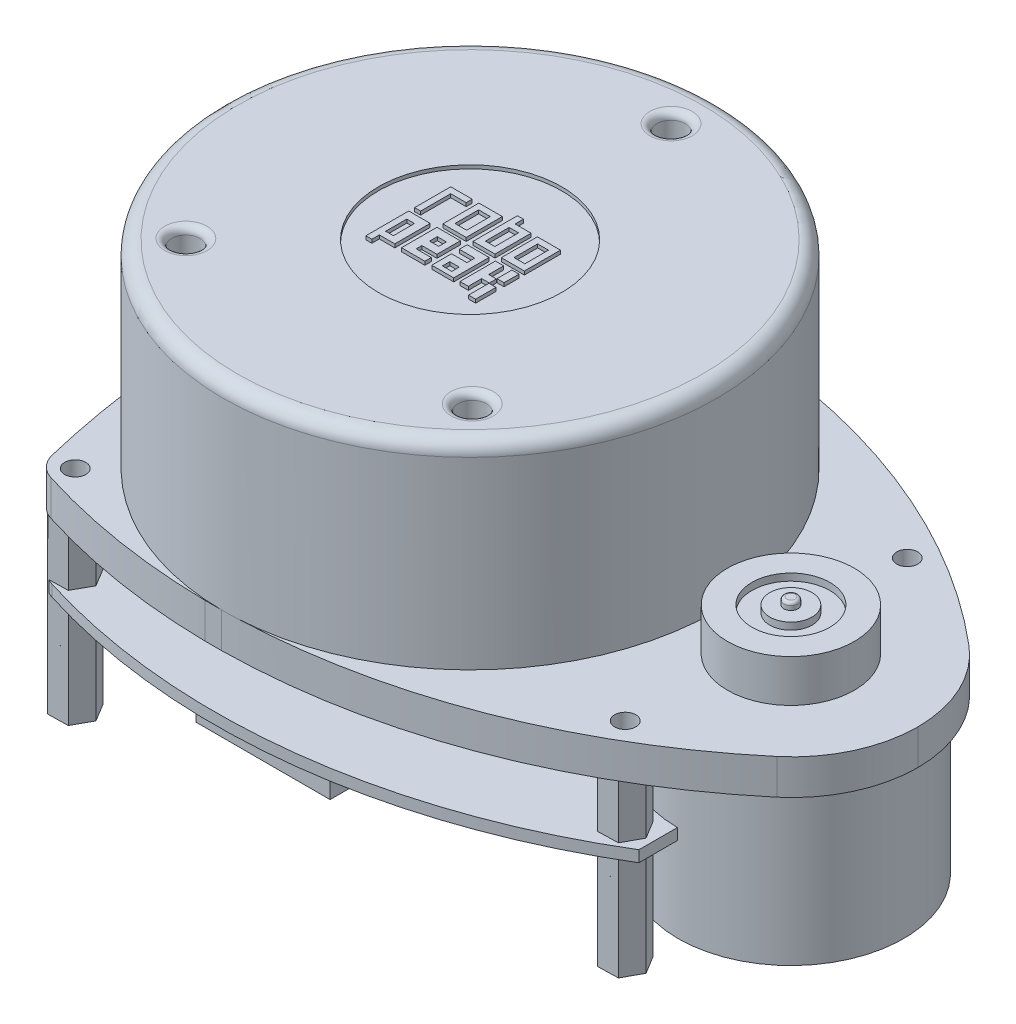
from build123d import *

# Parameters (mm, degrees)
SKETCH_1_W          = 98.5
SKETCH_1_H          = 70
EXTRUDE_1_DEPTH     = 5
SKETCH_2_R          = 35
EXTRUDE_2_DEPTH     = 28.1
SKETCH_3_R          = 2
CUT_EXTRUDE_1_DEPTH = 5
FILLET_1_R          = 2
FILLET_2_R          = 1
SKETCH_4_R          = 13
SKETCH_4_W          = 3.316540618
SKETCH_4_H          = 5.120069114
SKETCH_4_W_2        = 3.276095001
SKETCH_4_W_3        = 1.001370982
SKETCH_4_H_2        = 2.121481923
SKETCH_4_H_3        = 2.893302243
SKETCH_4_W_4        = 1.096399653
SKETCH_4_H_4        = 2.99297568
SKETCH_4_W_5        = 1.536933457
SKETCH_4_H_5        = 3.356986235
SKETCH_4_W_6        = 1.658270309
SKETCH_4_W_7        = 1.334705371
SKETCH_4_H_6        = 1.05158605
SKETCH_4_W_8        = 1.294259754
SKETCH_4_H_7        = 1.092031667
CUT_EXTRUDE_3_DEPTH = 0.5
SKETCH_5_R          = 1.25
CUT_EXTRUDE_4_DEPTH = 5
SKETCH_6_R          = 9
EXTRUDE_3_DEPTH     = 7
CUT_EXTRUDE_START   = -1
SKETCH_7_R          = 9
SKETCH_7_R_2        = 0.99350654
CUT_EXTRUDE_5_DEPTH = 1
SKETCH_8_R          = 5.521677929
SKETCH_8_R_2        = 3.001097475
CUT_EXTRUDE_6_DEPTH = 1
FILLET_3_R          = 0.4
SKETCH_9_R          = 16
EXTRUDE_4_DEPTH     = 27
EXTRUDE_5_DEPTH     = 24.6
SKETCH_11_R         = 26
EXTRUDE_6_DEPTH     = 8
FILLET_4_R          = 1
SKETCH_12_W         = 106.251501727
SKETCH_12_H         = 75.565901032
CUT_EXTRUDE_7_DEPTH = 8
FILLET_5_R          = 100
EXTRUDE_START       = 8
EXTRUDE_7_DEPTH     = 1.6
SKETCH_14_W         = 20
SKETCH_14_H         = 5
EXTRUDE_8_DEPTH     = 6
CHAMFER_1_SIZE      = 1
SKETCH1_R           = 1.5
CUT_EXTRUDE1_DEPTH  = 30


with BuildPart() as part:
    # Эскиз1 → Бобышка-Вытянуть1 (new body)
    with BuildSketch(Plane(origin=(0, 0, 0), x_dir=(1, 0, 0), z_dir=(0, 1, 0))):
        Rectangle(SKETCH_1_W, SKETCH_1_H)
    extrude(amount=EXTRUDE_1_DEPTH)

    # Эскиз2 → Бобышка-Вытянуть2 (add)
    with BuildSketch(Plane(origin=(0, 5, 0), x_dir=(1, 0, 0), z_dir=(0, 1, 0))):
        with Locations(Location((-14.25, 0, 0), (0, 0, 270))):
            Circle(SKETCH_2_R)
    extrude(amount=EXTRUDE_2_DEPTH)

    # Эскиз3 → Вырез-Вытянуть1 (cut)
    with BuildSketch(Plane(origin=(0, 33.1, 0), x_dir=(1, 0, 0), z_dir=(0, 1, 0))):
        with Locations(Location((-14.25, 28.5, 0), (0, 0, 270))):
            Circle(SKETCH_3_R)
        with Locations(Location((-34.553940504, -20, 0), (0, 0, 270))):
            Circle(SKETCH_3_R)
        with Locations(Location((6.053940504, -20, 0), (0, 0, 270))):
            Circle(SKETCH_3_R)
    extrude(amount=-CUT_EXTRUDE_1_DEPTH, mode=Mode.SUBTRACT)

    # Скругление1
    fillet_1_edges = [part.edges().sort_by_distance(p)[0] for p in [
        (-14.25, 33.1, -35),
    ]]
    fillet(fillet_1_edges, radius=FILLET_1_R)

    # Скругление2
    fillet_2_edges = [part.edges().sort_by_distance(p)[0] for p in [
        (-14.25, 33.1, -30.5),
        (-34.553940504, 33.1, 18),
        (6.053940504, 33.1, 18),
    ]]
    fillet(fillet_2_edges, radius=FILLET_2_R)

    # Эскиз4 → Вырез-Вытянуть3 (cut)
    # profile 1 of 7: a face of its own
    with BuildSketch(Plane(origin=(0, 33.1, 0), x_dir=(1, 0, 0), z_dir=(0, 1, 0))):
        with Locations(Location((-14.25, 0, 0), (0, 0, 270))):
            Circle(SKETCH_4_R)
        Polygon((-22.115166942, -6.914876839), (-22.115166942, -0.831627154), (-19.0735421, -0.831627154), (-19.0735421, -5.853844917), (-21.266341405, -5.853844917), (-21.266341405, -6.914876839), align=None, mode=Mode.SUBTRACT)
        Polygon((-22.115166942, 0), (-22.115166942, 5.120069114), (-19.0735421, 5.120069114), (-19.0735421, 4.27071115), (-21.266341405, 4.27071115), (-21.266341405, 0), align=None, mode=Mode.SUBTRACT)
        Polygon((-13.829606569, 0), (-13.829606569, 6.292992015), (-12.980248606, 6.292992015), (-12.980248606, 5.120069114), (-10.715294037, 5.120069114), (-10.715294037, 0), align=None, mode=Mode.SUBTRACT)
        with Locations((-16.458571693, 2.560034557)):
            Rectangle(SKETCH_4_W, SKETCH_4_H, mode=Mode.SUBTRACT)
        with Locations((-8.187442955, 2.560034557)):
            Rectangle(SKETCH_4_W_2, SKETCH_4_H, mode=Mode.SUBTRACT)
        with Locations((-7.050080946, -1.825090787)):
            Rectangle(SKETCH_4_W_3, SKETCH_4_H_2, mode=Mode.SUBTRACT)
        with Locations((-7.050080946, -5.468225718)):
            Rectangle(SKETCH_4_W_3, SKETCH_4_H_3, mode=Mode.SUBTRACT)
        Polygon((-9.825490456, -0.831627154), (-8.643651064, -0.831627154), (-8.643651064, -2.960833634), (-7.550766437, -2.960833634), (-7.550766437, -3.957287265), (-8.643651064, -3.957287265), (-8.643651064, -5.853844917), (-9.825490456, -5.853844917), align=None, mode=Mode.SUBTRACT)
        Polygon((-13.829606569, -0.831627154), (-10.715294037, -0.831627154), (-10.715294037, -5.853844917), (-13.829606569, -5.853844917), (-13.829606569, -3.04994558), (-11.645543235, -3.04994558), (-11.645543235, -1.940786367), (-13.829606569, -1.940786367), align=None, mode=Mode.SUBTRACT)
        Polygon((-18.116842002, -0.831627154), (-14.800301384, -0.831627154), (-14.800301384, -4.141977247), (-16.943919101, -4.141977247), (-16.943919101, -4.950889593), (-14.800301384, -4.950889593), (-14.800301384, -5.853844917), (-18.116842002, -5.853844917), align=None, mode=Mode.SUBTRACT)
    # profile 2 of 7: a face of its own
    with BuildSketch(Plane(origin=(0, 33.1, 0), x_dir=(1, 0, 0), z_dir=(0, 1, 0))):
        with Locations((-20.718141579, -3.454401753)):
            Rectangle(SKETCH_4_W_4, SKETCH_4_H_4)
    # profile 3 of 7: a face of its own
    with BuildSketch(Plane(origin=(0, 33.1, 0), x_dir=(1, 0, 0), z_dir=(0, 1, 0))):
        with Locations((-8.167220148, 2.592218033)):
            Rectangle(SKETCH_4_W_5, SKETCH_4_H_5)
    # profile 4 of 7: a face of its own
    with BuildSketch(Plane(origin=(0, 33.1, 0), x_dir=(1, 0, 0), z_dir=(0, 1, 0))):
        with Locations((-16.478794502, 2.592218033)):
            Rectangle(SKETCH_4_W_6, SKETCH_4_H_5)
    # profile 5 of 7: a face of its own
    with BuildSketch(Plane(origin=(0, 33.1, 0), x_dir=(1, 0, 0), z_dir=(0, 1, 0))):
        with Locations((-12.312895921, 2.592218033)):
            Rectangle(SKETCH_4_W_7, SKETCH_4_H_5)
    # profile 6 of 7: a face of its own
    with BuildSketch(Plane(origin=(0, 33.1, 0), x_dir=(1, 0, 0), z_dir=(0, 1, 0))):
        with Locations((-12.312895921, -4.667770272)):
            Rectangle(SKETCH_4_W_7, SKETCH_4_H_6)
    # profile 7 of 7: a face of its own
    with BuildSketch(Plane(origin=(0, 33.1, 0), x_dir=(1, 0, 0), z_dir=(0, 1, 0))):
        with Locations((-16.296789224, -2.503929746)):
            Rectangle(SKETCH_4_W_8, SKETCH_4_H_7)
    extrude(amount=-CUT_EXTRUDE_3_DEPTH, mode=Mode.SUBTRACT)

    # Эскиз5 → Вырез-Вытянуть4 (cut)
    with BuildSketch(Plane(origin=(0, 5, 0), x_dir=(1, 0, 0), z_dir=(0, 1, 0))):
        with Locations(Location((-42.25, 28, 0), (0, 0, 270))):
            Circle(SKETCH_5_R)
        with Locations(Location((27.75, 20, 0), (0, 0, 270))):
            Circle(SKETCH_5_R)
        with Locations(Location((27.75, -20, 0), (0, 0, 90))):
            Circle(SKETCH_5_R)
        with Locations(Location((-42.25, -28, 0), (0, 0, 90))):
            Circle(SKETCH_5_R)
    extrude(amount=-CUT_EXTRUDE_4_DEPTH, mode=Mode.SUBTRACT)

    # Эскиз6 → Бобышка-Вытянуть3 (add)
    with BuildSketch(Plane(origin=(0, 5, 0), x_dir=(1, 0, 0), z_dir=(0, 1, 0))):
        with Locations(Location((31.25, 0, 0), (0, 0, 270))):
            Circle(SKETCH_6_R)
    extrude(amount=EXTRUDE_3_DEPTH)

    # Эскиз7 → Вырез-Вытянуть5 (cut)
    with BuildSketch(Plane(origin=(0, 12, 0), x_dir=(1, 0, 0), z_dir=(0, 1, 0)).offset(CUT_EXTRUDE_START)):
        with Locations(Location((31.25, 0, 0), (0, 0, 270))):
            Circle(SKETCH_7_R)
        with Locations(Location((31.25, 0, 0), (0, 0, 270))):
            Circle(SKETCH_7_R_2, mode=Mode.SUBTRACT)
    extrude(amount=CUT_EXTRUDE_5_DEPTH, mode=Mode.SUBTRACT)

    # Эскиз8 → Вырез-Вытянуть6 (cut)
    with BuildSketch(Plane(origin=(0, 11, 0), x_dir=(1, 0, 0), z_dir=(0, 1, 0))):
        with Locations(Location((31.25, 0, 0), (0, 0, 270))):
            Circle(SKETCH_8_R)
        with Locations(Location((31.25, 0, 0), (0, 0, 270))):
            Circle(SKETCH_8_R_2, mode=Mode.SUBTRACT)
    extrude(amount=-CUT_EXTRUDE_6_DEPTH, mode=Mode.SUBTRACT)

    # Скругление3
    fillet_3_edges = [part.edges().sort_by_distance(p)[0] for p in [
        (31.25, 12, -0.99350654),
    ]]
    fillet(fillet_3_edges, radius=FILLET_3_R)

    # Эскиз9 → Бобышка-Вытянуть4 (add)
    with BuildSketch(Plane(origin=(0, 5, 0), x_dir=(1, 0, 0), z_dir=(0, 1, 0))):
        with Locations(Location((31.25, 0, 0), (0, 0, 270))):
            Circle(SKETCH_9_R)
    extrude(amount=-EXTRUDE_4_DEPTH)

    # Эскиз10 → Бобышка-Вытянуть5 (add)
    with BuildSketch(Plane.XZ):
        Polygon((-40.854614908, 25.472900125), (-39.363774764, 27.944889), (-40.759159856, 30.471988875), (-43.645385092, 30.527099875), (-45.136225236, 28.055111), (-43.740840144, 25.528011125), align=None)
        Polygon((29.257133708, 22.462088812), (26.371335397, 22.536260484), (24.864201688, 20.074171672), (26.242866292, 17.537911188), (29.128664603, 17.463739516), (30.635798312, 19.925828328), align=None)
        Polygon((30.635798312, -19.925828328), (29.257133708, -22.462088812), (26.371335397, -22.536260484), (24.864201688, -20.074171672), (26.242866292, -17.537911188), (29.128664603, -17.463739516), align=None)
        Polygon((-43.740840144, -25.528011125), (-40.854614908, -25.472900125), (-39.363774764, -27.944889), (-40.759159856, -30.471988875), (-43.645385092, -30.527099875), (-45.136225236, -28.055111), align=None)
    extrude(amount=EXTRUDE_5_DEPTH)

    # Эскиз11 → Бобышка-Вытянуть6 (add)
    with BuildSketch(Plane(origin=(0, 5, 0), x_dir=(1, 0, 0), z_dir=(0, 1, 0))):
        with Locations(Location((-14.25, 0, 0), (0, 0, 270))):
            Circle(SKETCH_11_R)
    extrude(amount=-EXTRUDE_6_DEPTH)

    # Скругление4
    fillet_4_edges = [part.edges().sort_by_distance(p)[0] for p in [
        (-14.25, -3, -26),
    ]]
    fillet(fillet_4_edges, radius=FILLET_4_R)

    # Эскиз12 → Вырез-Вытянуть7 (cut)
    with BuildSketch(Plane(origin=(0, 5, 0), x_dir=(1, 0, 0), z_dir=(0, 1, 0))):
        with Locations((-0.925367694, -0.052186396)):
            Rectangle(SKETCH_12_W, SKETCH_12_H)
        with BuildLine():
            ThreePointArc((-49.25, 0), (-48.116981176, 14.083966884), (-45.528607092, 27.974329531))
            ThreePointArc((-45.528607092, 27.974329531), (-44.561596332, 29.769996926), (-42.834972324, 30.855492545))
            ThreePointArc((-42.834972324, 30.855492545), (2.249574036, 33.221442581), (42.908955543, 13.599293477))
            ThreePointArc((42.908955543, 13.599293477), (47.577997957, 7.498372972), (49.25, 0))
            ThreePointArc((49.25, 0), (47.577997957, -7.498372972), (42.908955543, -13.599293477))
            ThreePointArc((42.908955543, -13.599293477), (2.249574036, -33.221442581), (-42.834972324, -30.855492545))
            ThreePointArc((-42.834972324, -30.855492545), (-44.561596332, -29.769996926), (-45.528607092, -27.974329531))
            ThreePointArc((-45.528607092, -27.974329531), (-48.116981176, -14.083966884), (-49.25, 0))
        make_face(mode=Mode.SUBTRACT)
    extrude(amount=-CUT_EXTRUDE_7_DEPTH, mode=Mode.SUBTRACT)

    # Скругление5
    # the kernel refuses this fillet: 100 mm, written as the material it takes off along each edge
    with BuildSketch(Plane(origin=(-49.25, 5, 0), x_dir=(0.06766370453174418, 0, 0.9977081853372963), z_dir=(0, -1, 0))) as fillet_5_piece_1:
        with BuildLine():
            CenterArc((6.776645039, -99.922318338), FILLET_5_R, 87.741474483, 12.276669201)
            ThreePointArc((-10.619357471, -1.44704684), (-5.323940761, -0.618859533), (0, 0))
            ThreePointArc((0, 0), (5.358747467, 0.105631125), (10.717494933, 0))
        make_face()
    extrude(amount=31.793737334, mode=Mode.SUBTRACT)

    # Эскиз13 → Бобышка-Вытянуть7 (add)
    with BuildSketch(Plane.XZ.offset(EXTRUDE_START)):
        with BuildLine():
            Line((31.553634402, 21.860321538), (31.553634402, 16.4))
            ThreePointArc((31.553634402, 16.4), (15.153634402, 0), (31.553634402, -16.4))
            Line((31.553634402, -16.4), (31.553634402, -21.860321538))
            ThreePointArc((31.553634402, -21.860321538), (-4.596615235, -34.347840749), (-42.683124513, -30.855492545))
            ThreePointArc((-42.683124513, -30.855492545), (-44.409748521, -29.769996926), (-45.37675928, -27.974329531))
            ThreePointArc((-45.37675928, -27.974329531), (-47.965133365, -14.083966884), (-49.098152188, 0))
            ThreePointArc((-49.098152188, 0), (-47.965133365, 14.083966884), (-45.37675928, 27.974329531))
            ThreePointArc((-45.37675928, 27.974329531), (-44.409748521, 29.769996926), (-42.683124513, 30.855492545))
            ThreePointArc((-42.683124513, 30.855492545), (-4.596615235, 34.347840749), (31.553634402, 21.860321538))
        make_face()
    extrude(amount=EXTRUDE_7_DEPTH)

    # Эскиз14 → Бобышка-Вытянуть8 (add)
    with BuildSketch(Plane.XZ.offset(9.6)):
        with Locations((-14.098152188, 27.5)):
            Rectangle(SKETCH_14_W, SKETCH_14_H)
    extrude(amount=EXTRUDE_8_DEPTH)

    # Фаска1
    chamfer_1_edges = [part.edges().sort_by_distance(p)[0] for p in [
        (-24.098152188, -12.6, 30),
    ]]
    chamfer(chamfer_1_edges, length=CHAMFER_1_SIZE)

    # Sketch1 → Cut-Extrude1 (cut)
    with BuildSketch(Plane(origin=(0, -25, 0), x_dir=(1, 0, 0), z_dir=(0, 1, 0))):
        with Locations(Location((-42.25, -28, 0), (0, 0, 90))):
            Circle(SKETCH1_R)
        with Locations(Location((-42.25, 28, 0), (0, 0, 270))):
            Circle(SKETCH1_R)
        with Locations(Location((27.75, 20, 0), (0, 0, 270))):
            Circle(SKETCH1_R)
        with Locations(Location((27.75, -20, 0), (0, 0, 90))):
            Circle(SKETCH1_R)
    extrude(amount=CUT_EXTRUDE1_DEPTH, mode=Mode.SUBTRACT)


solid = part.part
